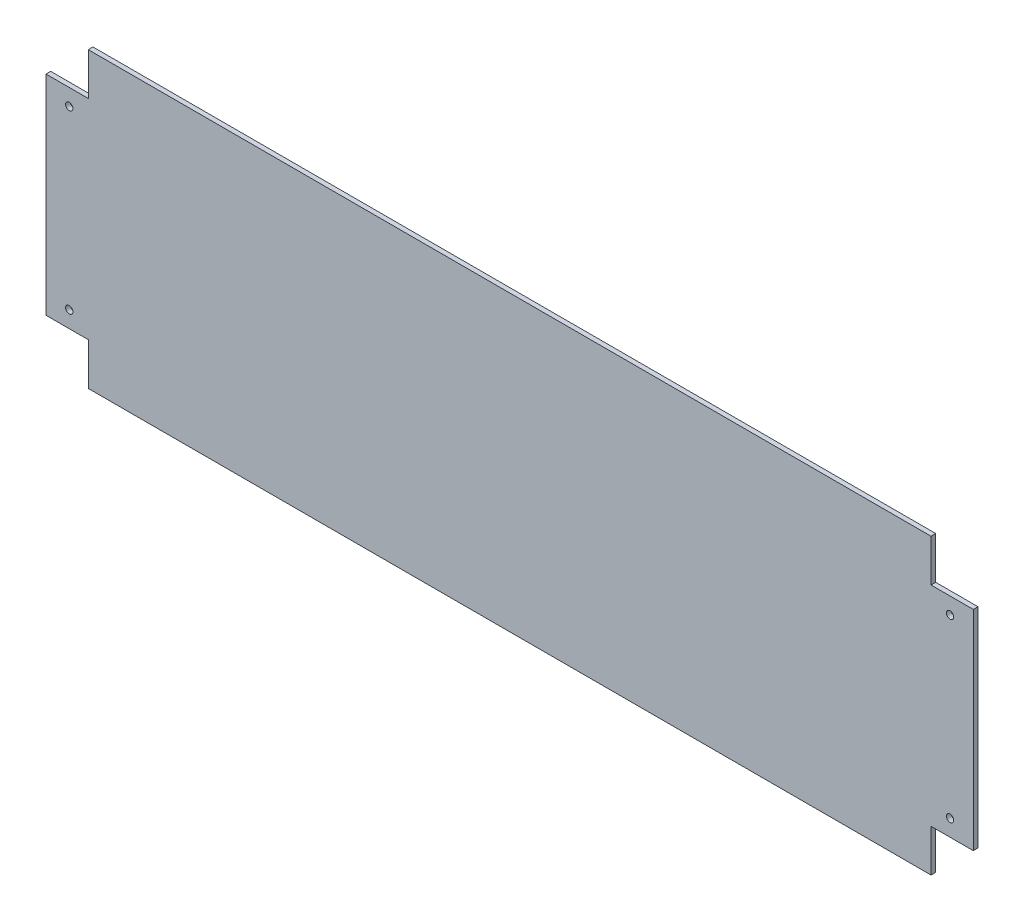
from build123d import *

# Parameters (mm, degrees)
SKETCH1_W               = 395
SKETCH1_H               = 125
BOSS_EXTRUDE1_DEPTH     = 2
SKETCH2_R               = 1.55
CUT_EXTRUDE1_DEPTH      = 208.162979318
SKETCH3_W               = 18
SKETCH3_H               = 18
CUT_EXTRUDE2_DEPTH      = 208.162979318
MIRROR2_COPY_1_SKETCH_W = 18
MIRROR2_COPY_1_SKETCH_H = 18
MIRROR2_COPY_1_DEPTH    = 208.162979318
MIRROR2_COPY_2_SKETCH_W = 18
MIRROR2_COPY_2_SKETCH_H = 18
MIRROR2_COPY_2_DEPTH    = 208.162979318


with BuildPart() as part:
    # Sketch1 → Boss-Extrude1 (new body)
    with BuildSketch(Plane.XY):
        Rectangle(SKETCH1_W, SKETCH1_H)
    extrude(amount=BOSS_EXTRUDE1_DEPTH)

    # Sketch2 → Cut-Extrude1 (cut, through all)
    with BuildSketch(Plane.XY.offset(2)):
        with Locations((-187.6, 37.5)):
            Circle(SKETCH2_R)
        with Locations((-187.6, -37.5)):
            Circle(SKETCH2_R)
        with Locations((187.6, 37.5)):
            Circle(SKETCH2_R)
        with Locations((187.6, -37.5)):
            Circle(SKETCH2_R)
    extrude(amount=-CUT_EXTRUDE1_DEPTH, mode=Mode.SUBTRACT)

    # Sketch3 → Cut-Extrude2 (cut, through all)
    with BuildSketch(Plane.XY.offset(2)):
        with Locations((-188.5, 53.5)):
            Rectangle(SKETCH3_W, SKETCH3_H)
    cut_extrude2 = extrude(amount=-CUT_EXTRUDE2_DEPTH, mode=Mode.SUBTRACT)

    # Mirror1: Cut-Extrude2 across plane
    add(cut_extrude2.mirror(Plane.ZX), mode=Mode.SUBTRACT)

    # Mirror2 copy 1 sketch → Mirror2 copy 1 (cut, through all)
    with BuildSketch(Plane(origin=(0, 0, 2), x_dir=(-1, 0, 0), z_dir=(0, 0, 1))):
        with Locations((-188.5, 53.5)):
            Rectangle(MIRROR2_COPY_1_SKETCH_W, MIRROR2_COPY_1_SKETCH_H)
    extrude(amount=-MIRROR2_COPY_1_DEPTH, mode=Mode.SUBTRACT)

    # Mirror2 copy 2 sketch → Mirror2 copy 2 (cut, through all)
    with BuildSketch(Plane(origin=(0, 0, 2), x_dir=(-1, 0, 0), z_dir=(0, 0, 1))):
        with Locations((-188.5, -53.5)):
            Rectangle(MIRROR2_COPY_2_SKETCH_W, MIRROR2_COPY_2_SKETCH_H)
    extrude(amount=-MIRROR2_COPY_2_DEPTH, mode=Mode.SUBTRACT)


solid = part.part
